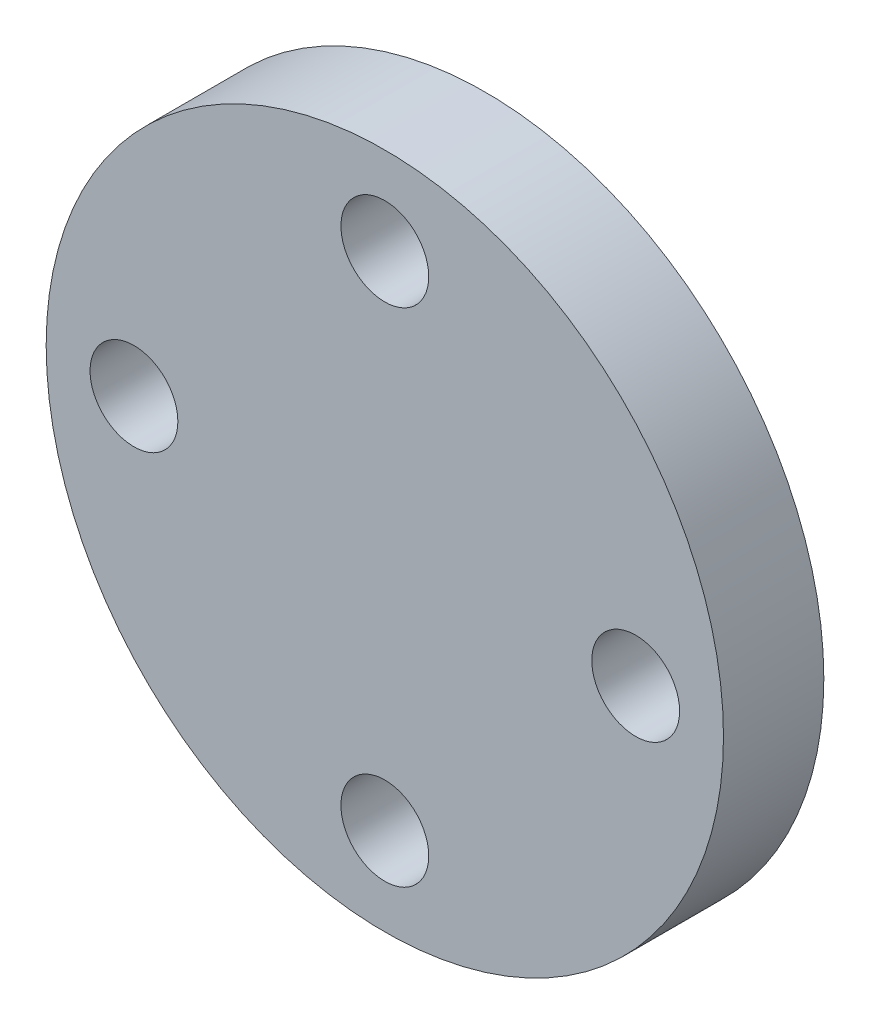
from build123d import *

# Parameters (mm, degrees)
SKETCH1_R           = 13.5
SKETCH1_R_2         = 1.75
BOSS_EXTRUDE1_DEPTH = 4


with BuildPart() as part:
    # Sketch1 → Boss-Extrude1 (new body)
    with BuildSketch(Plane.XY):
        Circle(SKETCH1_R)
        with Locations((-10, 0)):
            Circle(SKETCH1_R_2, mode=Mode.SUBTRACT)
        with Locations((0, 10)):
            Circle(SKETCH1_R_2, mode=Mode.SUBTRACT)
        with Locations((10, 0)):
            Circle(SKETCH1_R_2, mode=Mode.SUBTRACT)
        with Locations((0, -10)):
            Circle(SKETCH1_R_2, mode=Mode.SUBTRACT)
    extrude(amount=BOSS_EXTRUDE1_DEPTH)


solid = part.part
